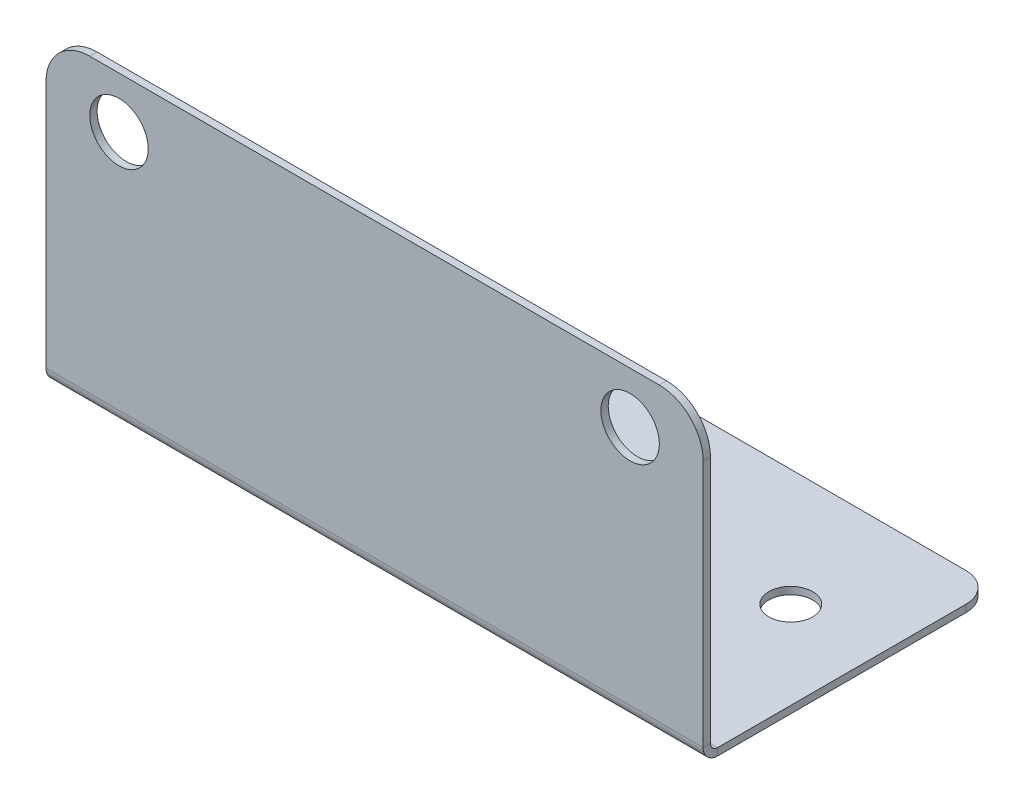
from build123d import *

# Parameters (mm, degrees)
SKETCH_1_W                       = 45
SKETCH_1_H                       = 20
EXTRUDE_1_DEPTH                  = 0.5
SM_EDGE_FLANGE_1_STRIP_W         = 3
SM_EDGE_FLANGE_1_STRIP_H         = 0.5
SM_EDGE_FLANGE_1_STRIP_CUT_DEPTH = 45
SM_EDGE_FLANGE_1_DEPTH           = 45
SKETCH_9_R                       = 2
CUT_EXTRUDE_1_DEPTH              = 0.5
CUT_EXTRUDE_2_DEPTH              = 0.5
SKETCH_11_R                      = 1.5
CUT_EXTRUDE_3_DEPTH              = 0.5
FILLET_1_R                       = 3
FILLET_2_R                       = 2


# Sheet-metal steps are written as plain solids
with BuildPart() as part:
    # Sketch 1 → Бобышка-Вытянуть1 (new body)
    with BuildSketch(Plane(origin=(0, 0, 0), x_dir=(1, 0, 0), z_dir=(0, 1, 0))):
        Rectangle(SKETCH_1_W, SKETCH_1_H)
    extrude(amount=EXTRUDE_1_DEPTH)

    # Ребро-кромка1 strip (across the edge) → Ребро-кромка1 strip cut (cut)
    with BuildSketch(Plane(origin=(-22.5, 0.5, 10), x_dir=(0, 0, -1), z_dir=(1, 0, 0))):
        with Locations((-0.5, -0.25)):
            Rectangle(SM_EDGE_FLANGE_1_STRIP_W, SM_EDGE_FLANGE_1_STRIP_H)
    extrude(amount=SM_EDGE_FLANGE_1_STRIP_CUT_DEPTH, mode=Mode.SUBTRACT)

    # Ребро-кромка1 section (across the edge) → Ребро-кромка1 (add)
    with BuildSketch(Plane(origin=(-22.5, 0.5, 10), x_dir=(0, 0, -1), z_dir=(1, 0, 0))):
        with BuildLine():
            Line((0, 0.5), (0, 20.5))
            Line((0, 20.5), (0.5, 20.5))
            Line((0.5, 20.5), (0.5, 0.5))
            ThreePointArc((0.5, 0.5), (0.646446609, 0.146446609), (1, 0))
            Line((1, 0), (1, -0.5))
            ThreePointArc((1, -0.5), (0.292893219, -0.207106781), (0, 0.5))
        make_face()
    extrude(amount=SM_EDGE_FLANGE_1_DEPTH)

    # Эскиз9 → Вырез-Вытянуть1 (cut)
    with BuildSketch(Plane.XY.offset(10)):
        with Locations((-17.5, 17.5)):
            Circle(SKETCH_9_R)
        with Locations(Location((17.5, 17.5, 0), (0, 0, 180))):
            Circle(SKETCH_9_R)
    extrude(amount=-CUT_EXTRUDE_1_DEPTH, mode=Mode.SUBTRACT)

    # Эскиз10 → Вырез-Вытянуть2 (cut)
    with BuildSketch(Plane(origin=(0, 0.5, 0), x_dir=(1, 0, 0), z_dir=(0, 1, 0))):
        with BuildLine():
            Line((-5.5, -4), (5.5, -4))
            ThreePointArc((5.5, -4), (8, -6.5), (5.5, -9))
            Line((5.5, -9), (-5.5, -9))
            ThreePointArc((-5.5, -9), (-8, -6.5), (-5.5, -4))
        make_face()
    extrude(amount=-CUT_EXTRUDE_2_DEPTH, mode=Mode.SUBTRACT)

    # Эскиз11 → Вырез-Вытянуть3 (cut)
    with BuildSketch(Plane(origin=(0, 0.5, 0), x_dir=(1, 0, 0), z_dir=(0, 1, 0))):
        with Locations(Location((-16.5, 2, 0), (0, 0, 270))):
            Circle(SKETCH_11_R)
        with Locations(Location((16.5, 2, 0), (0, 0, 90))):
            Circle(SKETCH_11_R)
    extrude(amount=-CUT_EXTRUDE_3_DEPTH, mode=Mode.SUBTRACT)

    # Скругление1
    fillet_1_edges = [part.edges().sort_by_distance(p)[0] for p in [
        (-22.5, 21, 9.75),
        (22.5, 21, 9.75),
    ]]
    fillet(fillet_1_edges, radius=FILLET_1_R)

    # Скругление2
    fillet_2_edges = [part.edges().sort_by_distance(p)[0] for p in [
        (22.5, 0.25, -10),
        (-22.5, 0.25, -10),
    ]]
    fillet(fillet_2_edges, radius=FILLET_2_R)


solid = part.part
